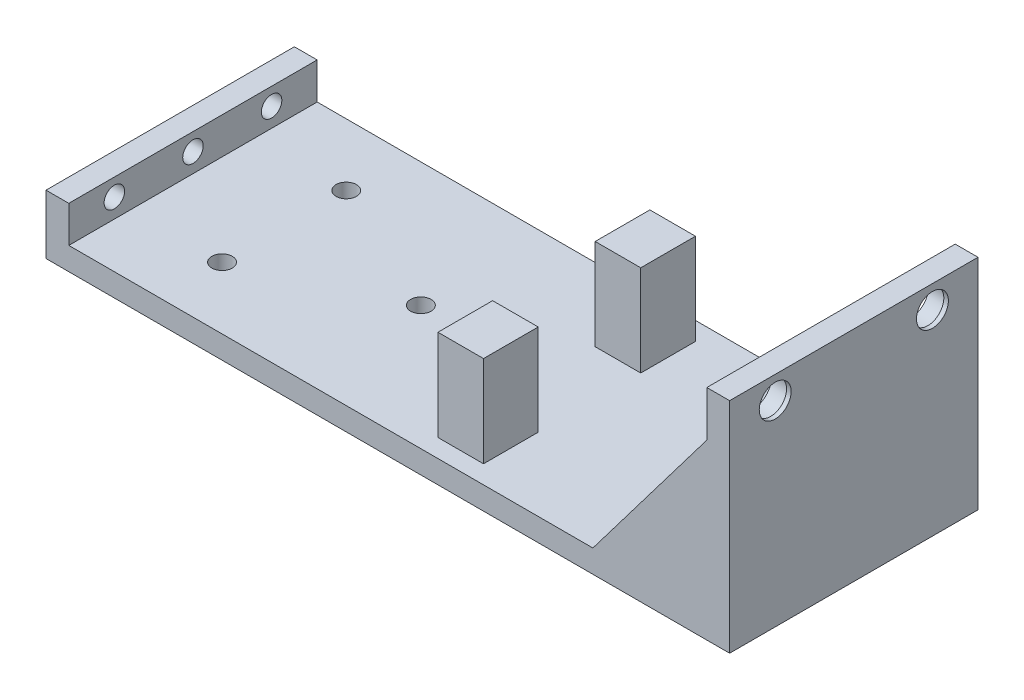
from build123d import *

# Parameters (mm, degrees)
SKETCH1_W                 = 150
SKETCH1_H                 = 54.5
BOSS_EXTRUDE1_DEPTH       = 5
SKETCH2_W                 = 5
SKETCH2_H                 = 54.5
BOSS_EXTRUDE2_DEPTH       = 8
F_8_CLEARANCE_HOLE1_D     = 4.4958
F_8_CLEARANCE_HOLE1_DEPTH = 17
F_8_CLEARANCE_HOLE1_TIP   = 1.350674586
SKETCH7_W                 = 5
SKETCH7_H                 = 54.5
BOSS_EXTRUDE3_DEPTH       = 43
SKETCH8_R                 = 4.25
CUT_EXTRUDE1_DEPTH        = 4
RIB1_REACH                = 120.085
SKETCH10_WALL_W           = 279.571445908
SKETCH10_WALL_H           = 10
RIB3_REACH                = 120.085
SKETCH12_WALL_W           = 279.571445908
SKETCH12_WALL_H           = 10
SKETCH13_W                = 8
SKETCH13_H                = 2
BOSS_EXTRUDE4_DEPTH       = 5
SKETCH14_R                = 2
CUT_EXTRUDE2_DEPTH        = 2
SKETCH15_R                = 3.5
CUT_EXTRUDE3_DEPTH        = 1
F_8_CLEARANCE_HOLE2_D     = 4.4958
F_8_CLEARANCE_HOLE2_DEPTH = 17
F_8_CLEARANCE_HOLE2_TIP   = 1.350674586
SKETCH16_W                = 10
SKETCH16_H                = 12
BOSS_EXTRUDE5_DEPTH       = 20
SKETCH18_W                = 7
SKETCH18_H                = 7
CUT_EXTRUDE4_DEPTH        = 8


with BuildPart() as part:
    # Sketch1 → Boss-Extrude1 (new body)
    with BuildSketch(Plane(origin=(0, 0, 0), x_dir=(1, 0, 0), z_dir=(0, 1, 0))):
        with Locations((-18.112463826, -1.689393939)):
            Rectangle(SKETCH1_W, SKETCH1_H)
    extrude(amount=BOSS_EXTRUDE1_DEPTH)

    # Sketch2 → Boss-Extrude2 (add)
    with BuildSketch(Plane(origin=(0, 5, 0), x_dir=(1, 0, 0), z_dir=(0, 1, 0))):
        with Locations((-90.612463826, -1.689393939)):
            Rectangle(SKETCH2_W, SKETCH2_H)
    extrude(amount=BOSS_EXTRUDE2_DEPTH)

    # #8 Clearance Hole1
    with Locations(Plane(origin=(-93.112463826, 9.2, -15.560606061), x_dir=(0, 0, -1), z_dir=(-1, 0, 0))):
        with Locations((0, 0), (-17.25, 0), (-34.5, 0)):
            Hole(F_8_CLEARANCE_HOLE1_D / 2, depth=F_8_CLEARANCE_HOLE1_DEPTH)
            with Locations((0, 0, -(F_8_CLEARANCE_HOLE1_DEPTH + F_8_CLEARANCE_HOLE1_TIP / 2))):  # 118° drill point
                Cone(0, F_8_CLEARANCE_HOLE1_D / 2, F_8_CLEARANCE_HOLE1_TIP, mode=Mode.SUBTRACT)

    # Sketch7 → Boss-Extrude3 (add)
    with BuildSketch(Plane(origin=(0, 5, 0), x_dir=(1, 0, 0), z_dir=(0, 1, 0))):
        with Locations((54.387536174, -1.689393939)):
            Rectangle(SKETCH7_W, SKETCH7_H)
    extrude(amount=BOSS_EXTRUDE3_DEPTH)

    # Sketch8 → Cut-Extrude1 (cut)
    with BuildSketch(Plane.ZY.offset(-51.887536174)):
        with Locations((-15.560606061, 43)):
            Circle(SKETCH8_R)
        with Locations((18.939393939, 43)):
            Circle(SKETCH8_R)
    extrude(amount=-CUT_EXTRUDE1_DEPTH, mode=Mode.SUBTRACT)

    # Sketch10 wall → Rib1 (add, up to next)
    with BuildSketch(Plane(origin=(39.387536174, 21.5, -25.560606061), x_dir=(-0.603857687995, -0.797092148154, 0), z_dir=(-0.797092148154, 0.603857687995, 0)), mode=Mode.PRIVATE) as rib1_sk1:
        with Locations((0, 5)):
            Rectangle(SKETCH10_WALL_W, SKETCH10_WALL_H)
    rib1_tool1 = extrude(rib1_sk1.sketch, amount=-RIB1_REACH, mode=Mode.PRIVATE) - part.part
    add(rib1_tool1.solids().sort_by_distance((39.387536174, 21.5, -25.560606061))[0])

    # Sketch12 wall → Rib3 (add, up to next)
    with BuildSketch(Plane(origin=(39.387536174, 21.5, 28.939393939), x_dir=(-0.603857687995, -0.797092148154, 0), z_dir=(0.797092148154, -0.603857687995, 0)), mode=Mode.PRIVATE) as rib3_sk1:
        with Locations((0, 5)):
            Rectangle(SKETCH12_WALL_W, SKETCH12_WALL_H)
    rib3_tool1 = extrude(rib3_sk1.sketch, amount=RIB3_REACH, mode=Mode.PRIVATE) - part.part
    add(rib3_tool1.solids().sort_by_distance((39.387536174, 21.5, 28.939393939))[0])

    # Sketch13 → Boss-Extrude4 (add)
    with BuildSketch(Plane.ZY.offset(-51.887536174)):
        with Locations((1.689393939, 37)):
            Rectangle(SKETCH13_W, SKETCH13_H)
    extrude(amount=BOSS_EXTRUDE4_DEPTH)

    # Sketch14 → Cut-Extrude2 (cut)
    with BuildSketch(Plane(origin=(0, 38, 0), x_dir=(1, 0, 0), z_dir=(0, 1, 0))):
        with Locations((49.387536174, -1.689393939)):
            Circle(SKETCH14_R)
    extrude(amount=-CUT_EXTRUDE2_DEPTH, mode=Mode.SUBTRACT)

    # Sketch15 → Cut-Extrude3 (cut)
    with BuildSketch(Plane.ZY.offset(-55.887536174)):
        with Locations((-15.560606061, 43)):
            Circle(SKETCH15_R)
        with Locations((18.939393939, 43)):
            Circle(SKETCH15_R)
    extrude(amount=-CUT_EXTRUDE3_DEPTH, mode=Mode.SUBTRACT)

    # #8 Clearance Hole2
    with Locations(Plane(origin=(-38.112463826, 5, 1.689393939), x_dir=(0, 0, 1), z_dir=(0, 1, 0))):
        with Locations((0, 0), (13.625, -30), (-13.625, -30)):
            Hole(F_8_CLEARANCE_HOLE2_D / 2, depth=F_8_CLEARANCE_HOLE2_DEPTH)
            with Locations((0, 0, -(F_8_CLEARANCE_HOLE2_DEPTH + F_8_CLEARANCE_HOLE2_TIP / 2))):  # 118° drill point
                Cone(0, F_8_CLEARANCE_HOLE2_D / 2, F_8_CLEARANCE_HOLE2_TIP, mode=Mode.SUBTRACT)

    # Sketch16 → Boss-Extrude5 (add)
    with BuildSketch(Plane(origin=(0, 5, 0), x_dir=(1, 0, 0), z_dir=(0, 1, 0))):
        with Locations((-6.112463826, 15.560606061)):
            Rectangle(SKETCH16_W, SKETCH16_H)
        with Locations((-6.112463826, -18.939393939)):
            Rectangle(SKETCH16_W, SKETCH16_H)
    extrude(amount=BOSS_EXTRUDE5_DEPTH)

    # Sketch18 → Cut-Extrude4 (cut)
    with BuildSketch(Plane.ZY.offset(11.112463826)):
        with Locations((-15.560606061, 20)):
            Rectangle(SKETCH18_W, SKETCH18_H)
        with Locations((18.939393939, 20)):
            Rectangle(SKETCH18_W, SKETCH18_H)
    extrude(amount=-CUT_EXTRUDE4_DEPTH, mode=Mode.SUBTRACT)


solid = part.part
